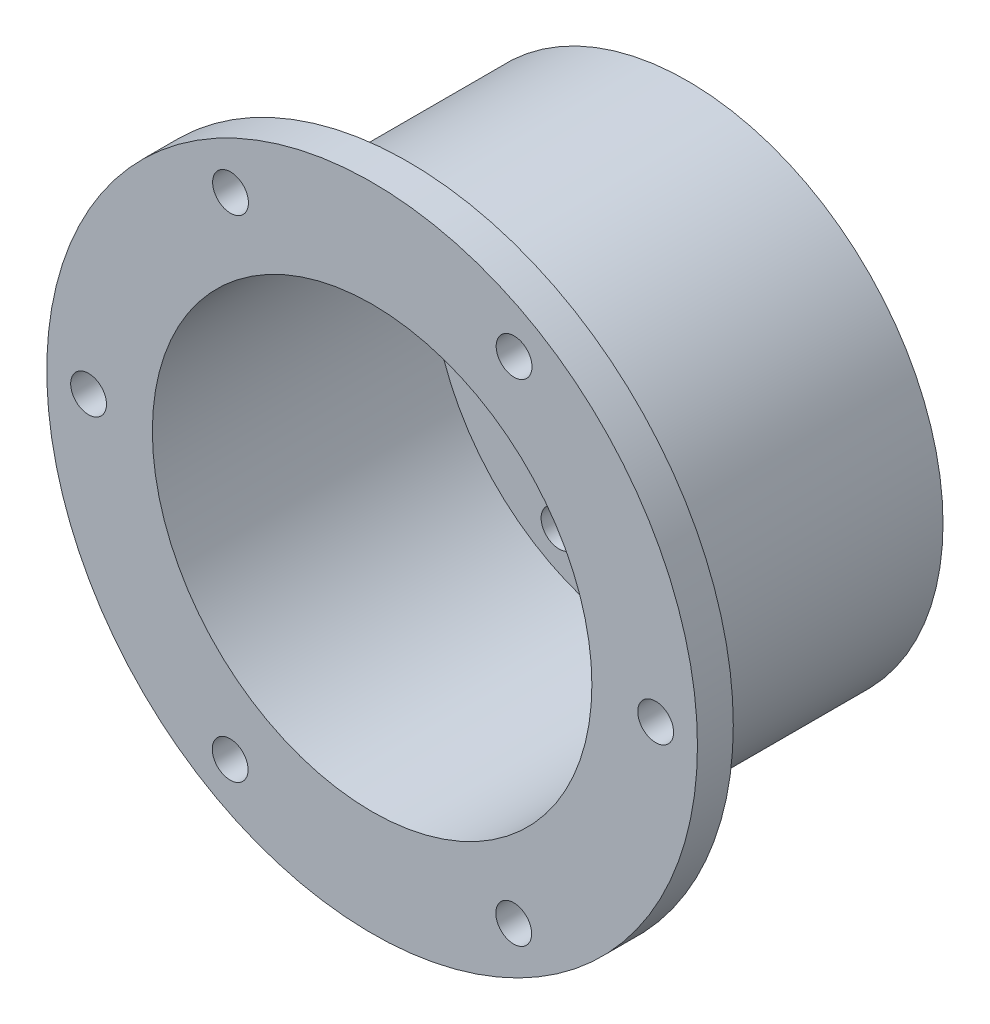
from build123d import *

# Parameters (mm, degrees)
CROQUIS1_R              = 21.4
CROQUIS1_R_2            = 18.4
SALIENTE_EXTRUIR1_DEPTH = 26.4
CROQUIS2_R              = 18.65
SALIENTE_EXTRUIR2_DEPTH = 3
SALIENTE_EXTRUIR3_START = -3
CROQUIS3_R              = 27.24
CROQUIS3_R_2            = 21.4
SALIENTE_EXTRUIR3_DEPTH = 3
CROQUIS4_R              = 6
CROQUIS4_R_2            = 1.5
CORTAR_EXTRUIR1_DEPTH   = 3
CROQUIS6_R              = 1.5
CORTAR_EXTRUIR2_DEPTH   = 3


with BuildPart() as part:
    # Croquis1 → Saliente-Extruir1 (new body)
    with BuildSketch(Plane.XY):
        Circle(CROQUIS1_R)
        Circle(CROQUIS1_R_2, mode=Mode.SUBTRACT)
    extrude(amount=SALIENTE_EXTRUIR1_DEPTH)

    # Croquis2 → Saliente-Extruir2 (add)
    with BuildSketch(Plane(origin=(0, 0, 0), x_dir=(-1, 0, 0), z_dir=(0, 0, -1))):
        Circle(CROQUIS2_R)
    extrude(amount=-SALIENTE_EXTRUIR2_DEPTH)

    # Croquis3 → Saliente-Extruir3 (add)
    with BuildSketch(Plane.XY.offset(26.4).offset(SALIENTE_EXTRUIR3_START)):
        Circle(CROQUIS3_R)
        Circle(CROQUIS3_R_2, mode=Mode.SUBTRACT)
    extrude(amount=SALIENTE_EXTRUIR3_DEPTH)

    # Croquis4 → Cortar-Extruir1 (cut)
    with BuildSketch(Plane(origin=(0, 0, 0), x_dir=(-1, 0, 0), z_dir=(0, 0, -1))):
        with Locations((0, -7)):
            Circle(CROQUIS4_R)
        with Locations((-15.5, 0)):
            Circle(CROQUIS4_R_2)
        with Locations((-7.75, 13.423393759)):
            Circle(CROQUIS4_R_2)
        with Locations((7.75, 13.423393759)):
            Circle(CROQUIS4_R_2)
        with Locations((15.5, 0)):
            Circle(CROQUIS4_R_2)
        with Locations((7.75, -13.423393759)):
            Circle(CROQUIS4_R_2)
        with Locations((-7.75, -13.423393759)):
            Circle(CROQUIS4_R_2)
    extrude(amount=-CORTAR_EXTRUIR1_DEPTH, mode=Mode.SUBTRACT)

    # Croquis6 → Cortar-Extruir2 (cut)
    with BuildSketch(Plane.XY.offset(26.4)):
        with Locations((-11.854123509, 20.568601212)):
            Circle(CROQUIS6_R)
        with Locations((11.885869416, 20.550272705)):
            Circle(CROQUIS6_R)
        with Locations((23.739992925, -0.018328508)):
            Circle(CROQUIS6_R)
        with Locations((11.854123509, -20.568601212)):
            Circle(CROQUIS6_R)
        with Locations((-11.885869416, -20.550272705)):
            Circle(CROQUIS6_R)
        with Locations((-23.739992925, 0.018328508)):
            Circle(CROQUIS6_R)
    extrude(amount=-CORTAR_EXTRUIR2_DEPTH, mode=Mode.SUBTRACT)


solid = part.part
